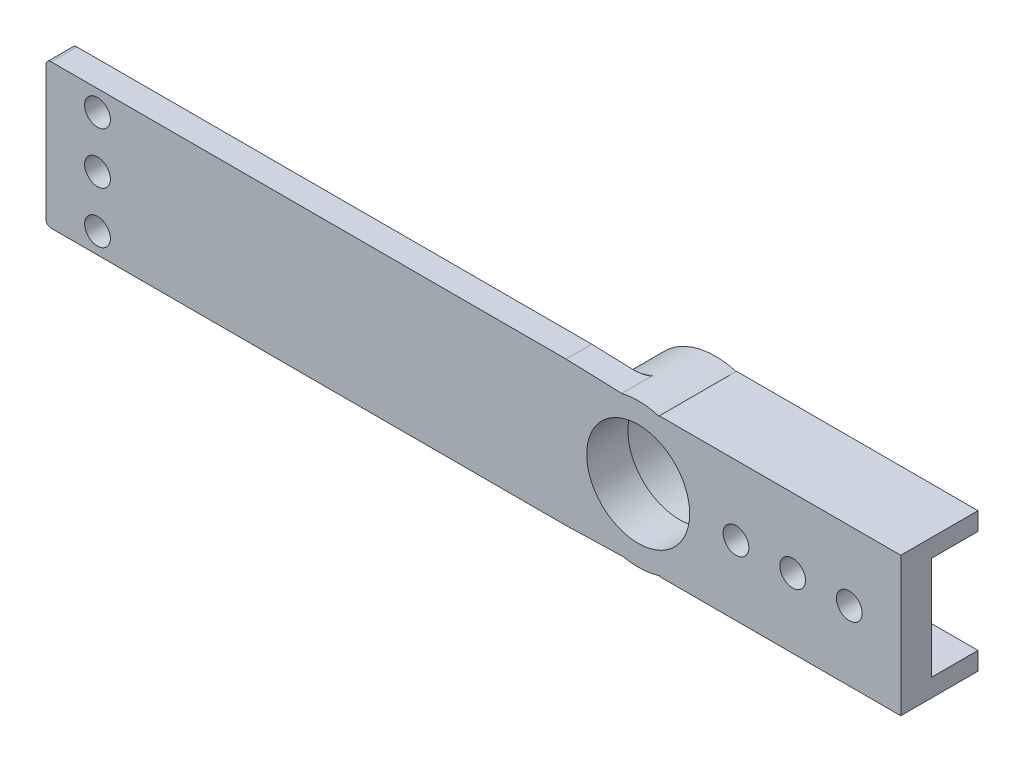
from build123d import *

# Parameters (mm, degrees)
SKETCH_1_W          = 40
SKETCH_1_H          = 20
EXTRUDE_1_DEPTH     = 6
SKETCH_2_R          = 2.5
CUT_EXTRUDE_1_DEPTH = 24.151673806
SKETCH_3_R          = 11
EXTRUDE_2_DEPTH     = 15
SKETCH_5_R          = 11
SKETCH_5_R_2        = 10
EXTRUDE_3_DEPTH     = 8
EXTRUDE_4_DEPTH     = 5
FILLET_1_R          = 1
FILLET_2_R          = 1
SKETCH_9_R          = 2.5
CUT_EXTRUDE_2_DEPTH = 5


with BuildPart() as part:
    # 草图1 → 凸台-拉伸1 (new body)
    with BuildSketch(Plane.XY):
        Rectangle(SKETCH_1_W, SKETCH_1_H)
    extrude(amount=EXTRUDE_1_DEPTH)

    # 草图2 → 切除-拉伸1 (cut, through all)
    with BuildSketch(Plane.XY.offset(6)):
        with Locations((10, 0)):
            Circle(SKETCH_2_R)
        with Locations((-1, 0)):
            Circle(SKETCH_2_R)
        with Locations((-12, 0)):
            Circle(SKETCH_2_R)
    extrude(amount=-CUT_EXTRUDE_1_DEPTH, mode=Mode.SUBTRACT)

    # 草图3 → 凸台-拉伸2 (add)
    with BuildSketch(Plane.XY.offset(6)):
        with BuildLine():
            Line((20, 10), (20, 13.5))
            Line((20, 13.5), (-26.893967141, 13.5))
            Line((-26.893967141, 13.5), (-26.893967141, 13.384337644))
            ThreePointArc((-26.893967141, 13.384337644), (-45, 0), (-26.893967141, -13.384337644))
            Line((-26.893967141, -13.384337644), (-26.893967141, -13.5))
            Line((-26.893967141, -13.5), (20, -13.5))
            Line((20, -13.5), (20, -10))
            Line((20, -10), (-20, -10))
            Line((-20, -10), (-20, -8.660254038))
            ThreePointArc((-20, -8.660254038), (-17, 0), (-20, 8.660254038))
            Line((-20, 8.660254038), (-20, 10))
            Line((-20, 10), (20, 10))
        make_face()
        with Locations((-31, 0)):
            Circle(SKETCH_3_R, mode=Mode.SUBTRACT)
    extrude(amount=-EXTRUDE_2_DEPTH)

    # 草图5 → 凸台-拉伸3 (add)
    with BuildSketch(Plane.XY.offset(6)):
        with Locations((-31, 0)):
            Circle(SKETCH_5_R)
        with Locations((-31, 0)):
            Circle(SKETCH_5_R_2, mode=Mode.SUBTRACT)
    extrude(amount=-EXTRUDE_3_DEPTH)

    # 草图8 → 凸台-拉伸4 (add)
    with BuildSketch(Plane.XY.offset(6)):
        with BuildLine():
            ThreePointArc((-33.911999365, -13.693803697), (-44.999289152, -0.141078849), (-34.187380521, 13.632336755))
            Line((-34.187380521, 13.632336755), (-45, 14))
            Line((-45, 14), (-146, 14))
            Line((-146, 14), (-146, -14))
            Line((-146, -14), (-45, -14))
            Line((-45, -14), (-33.911999365, -13.693803697))
        make_face()
    extrude(amount=-EXTRUDE_4_DEPTH)

    # 圆角1
    fillet_1_edges = [part.edges().sort_by_distance(p)[0] for p in [
        (-44.999289152, -0.141078849, 1),
    ]]
    fillet(fillet_1_edges, radius=FILLET_1_R)

    # 圆角2
    fillet_2_edges = [part.edges().sort_by_distance(p)[0] for p in [
        (-146, 14, 3.5),
        (-146, -14, 3.5),
    ]]
    fillet(fillet_2_edges, radius=FILLET_2_R)

    # 草图9 → 切除-拉伸2 (cut)
    with BuildSketch(Plane.XY.offset(6)):
        with Locations((-136, 0)):
            Circle(SKETCH_9_R)
        with Locations((-136, 10)):
            Circle(SKETCH_9_R)
        with Locations((-136, -10)):
            Circle(SKETCH_9_R)
    extrude(amount=-CUT_EXTRUDE_2_DEPTH, mode=Mode.SUBTRACT)


solid = part.part
